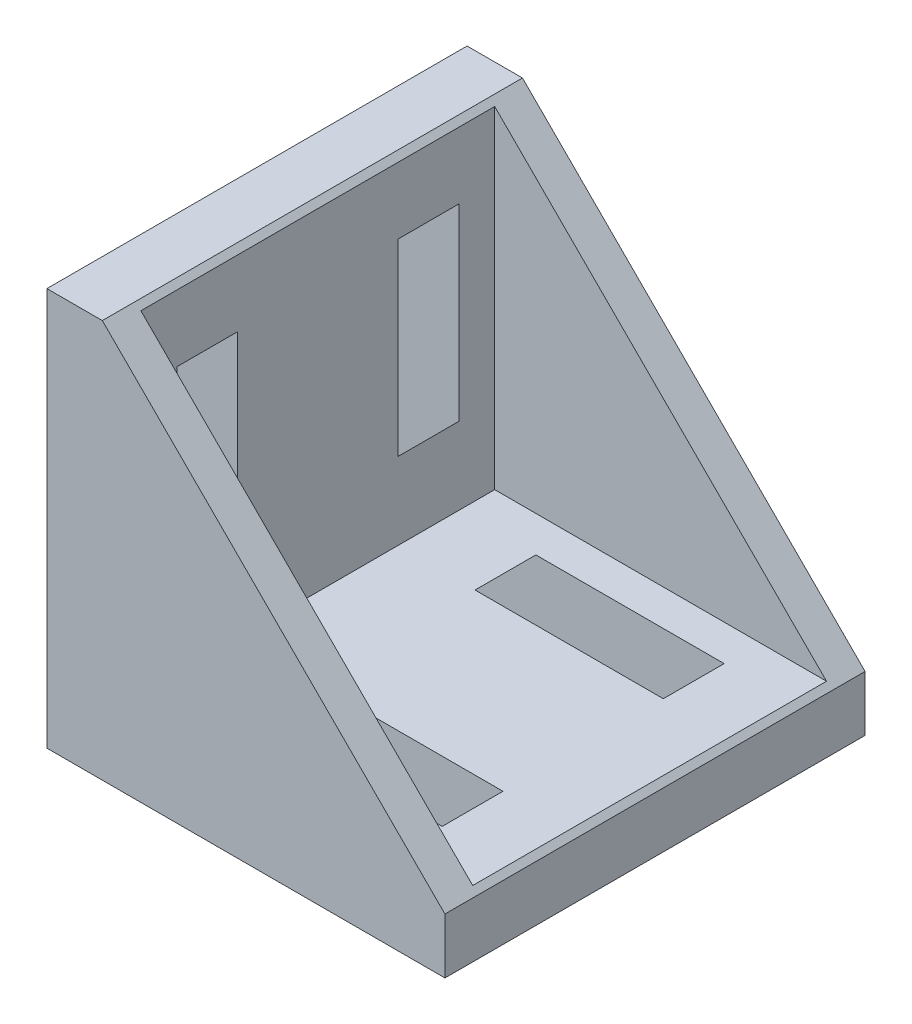
from build123d import *

# Parameters (mm, degrees)
BOSS_EXTRUDE1_DEPTH = 19
CUT_EXTRUDE1_START  = -16
CUT_EXTRUDE1_DEPTH  = 32
MIRROR1_START       = -12.75
MIRROR1_DEPTH       = 5.5
MIRROR1_START_2     = 7.25
MIRROR1_2_DEPTH     = 5.5
MIRROR1_START_3     = -12.5
MIRROR1_3_DEPTH     = 5
MIRROR1_START_4     = 7.5
MIRROR1_4_DEPTH     = 5


# Read off the part's stored shape, not the designer's step: Mirror1
with BuildPart() as part:
    # Sketch1 → Boss-Extrude1 (new, symmetric)
    with BuildSketch(Plane.XY):
        Polygon((0, 0), (0, 36), (5.012193309, 36), (36, 5.012193309), (36, 0), align=None)
    extrude(amount=BOSS_EXTRUDE1_DEPTH, both=True)

    # Sketch2 → Cut-Extrude1 (cut)
    with BuildSketch(Plane.XY.offset(CUT_EXTRUDE1_START)):
        Polygon((5.5, 35.512193309), (5.5, 5.5), (35.512193309, 5.5), align=None)
    extrude(amount=CUT_EXTRUDE1_DEPTH, mode=Mode.SUBTRACT)

    # Mirror1 outline → Mirror1 (cut)
    with BuildSketch(Plane.XY.offset(MIRROR1_START)):
        Polygon((5.5, 12.472329862), (5.5, 29.5), (0, 29.5), (0, 6.363961031), align=None)
        Polygon((29.5, 5.5), (12.472329862, 5.5), (6.363961031, 0), (29.5, 0), align=None)
    extrude(amount=MIRROR1_DEPTH, mode=Mode.SUBTRACT)

    # Mirror1 2 outline → Mirror1 2 (cut)
    with BuildSketch(Plane.XY.offset(MIRROR1_START_2)):
        Polygon((5.5, 12.472329862), (5.5, 29.5), (0, 29.5), (0, 6.363961031), align=None)
        Polygon((29.5, 5.5), (12.472329862, 5.5), (6.363961031, 0), (29.5, 0), align=None)
    extrude(amount=MIRROR1_2_DEPTH, mode=Mode.SUBTRACT)

    # Mirror1 3 outline → Mirror1 3 (add)
    with BuildSketch(Plane.XY.offset(MIRROR1_START_3)):
        Polygon((35.3, 0), (32.999216572, 0), (32.072195597, -1.013438577), (33.043379246, -2), align=None)
        Polygon((-1.013438577, 32.072195597), (0, 32.999216572), (0, 35.3), (-2, 33.043379246), align=None)
        Polygon((0, 1.234750477), (0, 3.535533906), (-2, 1.278913151), (-1.013438577, 0.307729503), align=None)
        Polygon((1.278913151, -2), (3.535533906, 0), (1.234750477, 0), (0.307729503, -1.013438577), align=None)
    extrude(amount=MIRROR1_3_DEPTH)

    # Mirror1 4 outline → Mirror1 4 (add)
    with BuildSketch(Plane.XY.offset(MIRROR1_START_4)):
        Polygon((35.3, 0), (32.999216572, 0), (32.072195597, -1.013438577), (33.043379246, -2), align=None)
        Polygon((-1.013438577, 32.072195597), (0, 32.999216572), (0, 35.3), (-2, 33.043379246), align=None)
        Polygon((0, 1.234750477), (0, 3.535533906), (-2, 1.278913151), (-1.013438577, 0.307729503), align=None)
        Polygon((1.278913151, -2), (3.535533906, 0), (1.234750477, 0), (0.307729503, -1.013438577), align=None)
    extrude(amount=MIRROR1_4_DEPTH)


solid = part.part
